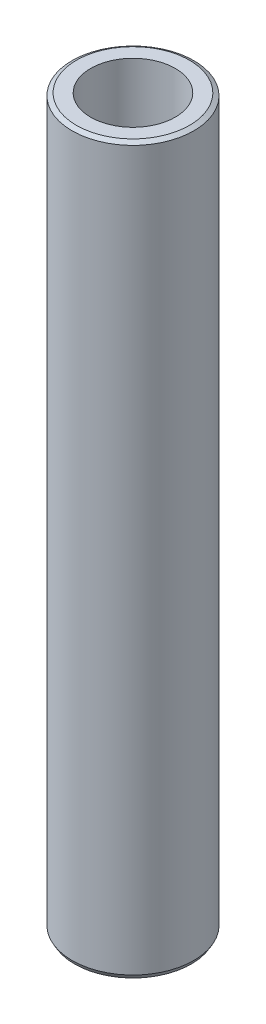
from build123d import *
from OCP.BRepFilletAPI import BRepFilletAPI_MakeChamfer

# Parameters (mm, degrees)
SKETCH1_R           = 42.5
BOSS_EXTRUDE1_DEPTH = 506.458577232
SKETCH2_R           = 29.540291906
CUT_EXTRUDE1_DEPTH  = 511.012539504
CHAMFER1_SIZE       = 1.756345659
CHAMFER1_SIZE2      = 3.042079918


with BuildPart() as part:
    # Sketch1 → Boss-Extrude1 (new body)
    with BuildSketch(Plane(origin=(0, 0, 0), x_dir=(1, 0, 0), z_dir=(0, 1, 0))):
        Circle(SKETCH1_R)
    extrude(amount=BOSS_EXTRUDE1_DEPTH)

    # Sketch2 → Cut-Extrude1 (cut, through all)
    with BuildSketch(Plane(origin=(0, 0, 0), x_dir=(1, 0, 0), z_dir=(0, 1, 0))):
        Circle(SKETCH2_R)
    extrude(amount=CUT_EXTRUDE1_DEPTH, mode=Mode.SUBTRACT)

    # Chamfer1: one chamfer whose edges measure the first distance from different faces: ONE call of the kernel's chamfer builder (chamfer() names one face for all edges)
    chamfer1_edges_1 = [part.edges().sort_by_distance(p)[0] for p in [
        (-42.5, 506.458577232, 0),
    ]]
    chamfer1_side_1 = [part.faces().sort_by_distance(p)[0] for p in [
        (-42.5, 253.229288616, 0),
    ]]
    chamfer1_edges_2 = [part.edges().sort_by_distance(p)[0] for p in [
        (-42.5, 0, 0),
    ]]
    chamfer1_side_2 = [part.faces().sort_by_distance(p)[0] for p in [
        (-41.297918472, 0, 0),
    ]]
    chamfer1 = BRepFilletAPI_MakeChamfer(part.part.solid().wrapped)
    for e in chamfer1_edges_1:
        chamfer1.Add(CHAMFER1_SIZE, CHAMFER1_SIZE2, e.wrapped, chamfer1_side_1[0].wrapped)  # the first distance lies on this face
    for e in chamfer1_edges_2:
        chamfer1.Add(CHAMFER1_SIZE, CHAMFER1_SIZE2, e.wrapped, chamfer1_side_2[0].wrapped)  # the first distance lies on this face
    add(Compound.cast(chamfer1.Shape()), mode=Mode.REPLACE)


solid = part.part
